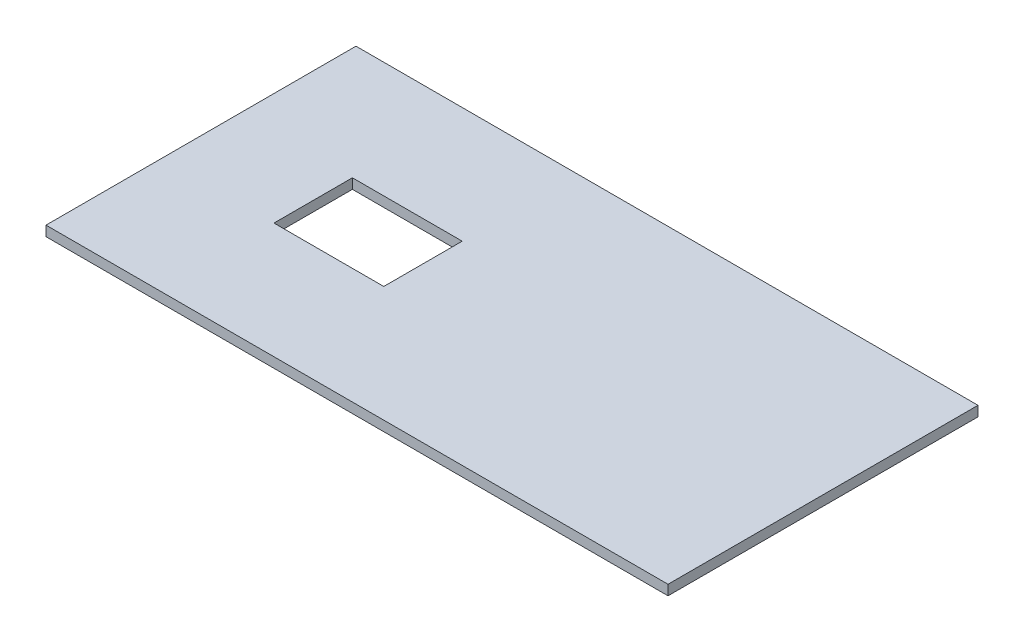
from build123d import *

# Parameters (mm, degrees)
SKETCH1_W           = 198.26
SKETCH1_H           = 98.8
SKETCH1_W_2         = 35
SKETCH1_H_2         = 25
BOSS_EXTRUDE1_DEPTH = 3.2


with BuildPart() as part:
    # Sketch1 → Boss-Extrude1 (new body)
    with BuildSketch(Plane(origin=(0, 0, 0), x_dir=(1, 0, 0), z_dir=(0, 1, 0))):
        with Locations((42.791840438, -20.896078056)):
            Rectangle(SKETCH1_W, SKETCH1_H)
        with Locations((-3.078159562, -20.896078056)):
            Rectangle(SKETCH1_W_2, SKETCH1_H_2, mode=Mode.SUBTRACT)
    extrude(amount=BOSS_EXTRUDE1_DEPTH)


solid = part.part
